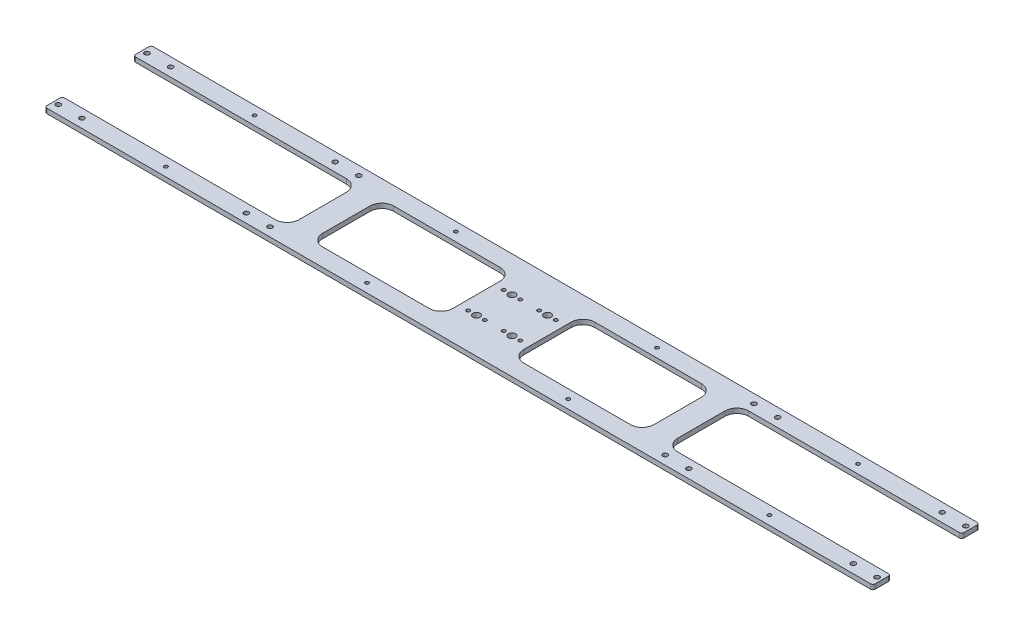
from build123d import *

# Parameters (mm, degrees)
SKETCH_1_W                                   = 700
SKETCH_1_H                                   = 90
SKETCH_1_W_2                                 = 280
SKETCH_1_H_2                                 = 60
EXTRUDE_1_DEPTH                              = 4
SKETCH_2_W                                   = 190
SKETCH_2_H                                   = 60
CUT_EXTRUDE_1_DEPTH                          = 4
SKETCH_4_R                                   = 2
CUT_EXTRUDE_2_DEPTH                          = 15
MIRROR_2_AT_THE_SECOND_PLANE_COPY_1_SKET_R   = 2
MIRROR_2_AT_THE_SECOND_PLANE_COPY_1_DEPTH    = 15
SKETCH_5_W                                   = 60
SKETCH_5_H                                   = 60
EXTRUDE_2_DEPTH                              = 4
SKETCH_6_R                                   = 1.5
CUT_EXTRUDE_3_DEPTH                          = 4
MIRROR_3_AT_THE_SECOND_PLANE_COPY_1_SKET_R   = 1.5
MIRROR_3_AT_THE_SECOND_PLANE_COPY_1_DEPTH    = 4
FILLET_1_R                                   = 2
MIRROR_6_DEPTH                               = 4
EXTRUDE_3_DEPTH                              = 4
MIRROR_9_AT_THE_SECOND_PLANE_COPY_1_DEPTH    = 4
SKETCH_8_R                                   = 3
SKETCH_8_R_2                                 = 1.5
CUT_EXTRUDE_4_DEPTH                          = 15
MIRROR_10_AT_THE_SECOND_PLANE_COPY_1_SKE_R   = 3
MIRROR_10_AT_THE_SECOND_PLANE_COPY_1_SKE_R_2 = 1.5
MIRROR_10_AT_THE_SECOND_PLANE_COPY_1_DEPTH   = 15


# Read off the part's stored shape, not the designer's step: 镜向6
with BuildPart() as part:
    # 草图1 → 凸台-拉伸1 (new body)
    with BuildSketch(Plane(origin=(0, 0, 0), x_dir=(1, 0, 0), z_dir=(0, 1, 0))):
        Rectangle(SKETCH_1_W, SKETCH_1_H)
        Rectangle(SKETCH_1_W_2, SKETCH_1_H_2, mode=Mode.SUBTRACT)
    extrude(amount=EXTRUDE_1_DEPTH)

    # 草图2 → 切除-拉伸1 (cut)
    with BuildSketch(Plane(origin=(0, 4, 0), x_dir=(1, 0, 0), z_dir=(0, 1, 0))):
        with Locations((-255, 0)):
            Rectangle(SKETCH_2_W, SKETCH_2_H)
    cut_extrude_1 = extrude(amount=-CUT_EXTRUDE_1_DEPTH, mode=Mode.SUBTRACT)

    # 镜向1: 切除-拉伸1 across plane
    add(cut_extrude_1.mirror(Plane(origin=(0, 0, 0), x_dir=(0, 0, 1), z_dir=(1, 0, 0))), mode=Mode.SUBTRACT)

    # 草图4 → 切除-拉伸2 (cut)
    with BuildSketch(Plane(origin=(0, 4, 0), x_dir=(1, 0, 0), z_dir=(0, 1, 0))):
        with Locations(Location((-187, 37.5, 0), (0, 0, 270))):
            Circle(SKETCH_4_R)
        with Locations(Location((-167, 37.5, 0), (0, 0, 270))):
            Circle(SKETCH_4_R)
        with Locations(Location((-346, 37.5, 0), (0, 0, 270))):
            Circle(SKETCH_4_R)
        with Locations(Location((-326, 37.5, 0), (0, 0, 270))):
            Circle(SKETCH_4_R)
    cut_extrude_2 = extrude(amount=-CUT_EXTRUDE_2_DEPTH, mode=Mode.SUBTRACT)

    # 镜向2: 切除-拉伸2 across plane
    add(cut_extrude_2.mirror(Plane(origin=(0, 0, 0), x_dir=(0, 0, 1), z_dir=(1, 0, 0))), mode=Mode.SUBTRACT)

    # 镜向2 at the second plane: 切除-拉伸2 across plane
    add(cut_extrude_2.mirror(Plane.XY), mode=Mode.SUBTRACT)

    # 镜向2 at the second plane copy 1 sket → 镜向2 at the second plane copy 1 (cut)
    with BuildSketch(Plane(origin=(0, 4, 0), x_dir=(-1, 0, 0), z_dir=(0, 1, 0))):
        with Locations(Location((-187, 37.5, 0), (0, 0, 270))):
            Circle(MIRROR_2_AT_THE_SECOND_PLANE_COPY_1_SKET_R)
        with Locations(Location((-167, 37.5, 0), (0, 0, 270))):
            Circle(MIRROR_2_AT_THE_SECOND_PLANE_COPY_1_SKET_R)
        with Locations(Location((-346, 37.5, 0), (0, 0, 270))):
            Circle(MIRROR_2_AT_THE_SECOND_PLANE_COPY_1_SKET_R)
        with Locations(Location((-326, 37.5, 0), (0, 0, 270))):
            Circle(MIRROR_2_AT_THE_SECOND_PLANE_COPY_1_SKET_R)
    extrude(amount=-MIRROR_2_AT_THE_SECOND_PLANE_COPY_1_DEPTH, mode=Mode.SUBTRACT)

    # 草图5 → 凸台-拉伸2 (add)
    with BuildSketch(Plane(origin=(0, 4, 0), x_dir=(1, 0, 0), z_dir=(0, 1, 0))):
        Rectangle(SKETCH_5_W, SKETCH_5_H)
    extrude(amount=-EXTRUDE_2_DEPTH)

    # 草图6 → 切除-拉伸3 (cut)
    with BuildSketch(Plane(origin=(0, 4, 0), x_dir=(1, 0, 0), z_dir=(0, 1, 0))):
        with Locations(Location((-255, 37.5, 0), (0, 0, 270))):
            Circle(SKETCH_6_R)
        with Locations(Location((-85, 37.5, 0), (0, 0, 270))):
            Circle(SKETCH_6_R)
    cut_extrude_3 = extrude(amount=-CUT_EXTRUDE_3_DEPTH, mode=Mode.SUBTRACT)

    # 镜向3: 切除-拉伸3 across plane
    add(cut_extrude_3.mirror(Plane.XY), mode=Mode.SUBTRACT)

    # 镜向3 at the second plane: 切除-拉伸3 across plane
    add(cut_extrude_3.mirror(Plane(origin=(0, 0, 0), x_dir=(0, 0, 1), z_dir=(1, 0, 0))), mode=Mode.SUBTRACT)

    # 镜向3 at the second plane copy 1 sket → 镜向3 at the second plane copy 1 (cut)
    with BuildSketch(Plane(origin=(0, 4, 0), x_dir=(-1, 0, 0), z_dir=(0, 1, 0))):
        with Locations(Location((-255, 37.5, 0), (0, 0, 270))):
            Circle(MIRROR_3_AT_THE_SECOND_PLANE_COPY_1_SKET_R)
        with Locations(Location((-85, 37.5, 0), (0, 0, 270))):
            Circle(MIRROR_3_AT_THE_SECOND_PLANE_COPY_1_SKET_R)
    extrude(amount=-MIRROR_3_AT_THE_SECOND_PLANE_COPY_1_DEPTH, mode=Mode.SUBTRACT)

    # 圆角1
    fillet_1_edges = [part.edges().sort_by_distance(p)[0] for p in [
        (-350, 2, -30),
        (-350, 2, -45),
    ]]
    fillet(fillet_1_edges, radius=FILLET_1_R)

    # 镜向6 outline → 镜向6 (cut)
    with BuildSketch(Plane(origin=(0, 0, 0), x_dir=(1, 0, 0), z_dir=(0, 1, 0))):
        with BuildLine():
            Line((350, 45), (348, 45))
            ThreePointArc((348, 45), (349.414213562, 44.414213562), (350, 43))
            Line((350, 43), (350, 45))
        make_face()
        with BuildLine():
            Line((350, 30), (350, 32))
            ThreePointArc((350, 32), (349.414213562, 30.585786438), (348, 30))
            Line((348, 30), (350, 30))
        make_face()
        with BuildLine():
            Line((-350, -45), (-348, -45))
            ThreePointArc((-348, -45), (-349.414213562, -44.414213562), (-350, -43))
            Line((-350, -43), (-350, -45))
        make_face()
        with BuildLine():
            ThreePointArc((348, -30), (349.414213562, -30.585786438), (350, -32))
            Line((350, -32), (350, -30))
            Line((350, -30), (348, -30))
        make_face()
        with BuildLine():
            ThreePointArc((350, -43), (349.414213562, -44.414213562), (348, -45))
            Line((348, -45), (350, -45))
            Line((350, -45), (350, -43))
        make_face()
        with BuildLine():
            Line((-350, -30), (-350, -32))
            ThreePointArc((-350, -32), (-349.414213562, -30.585786438), (-348, -30))
            Line((-348, -30), (-350, -30))
        make_face()
    extrude(amount=MIRROR_6_DEPTH, mode=Mode.SUBTRACT)

    # 草图7 → 凸台-拉伸3 (add)
    with BuildSketch(Plane(origin=(0, 4, 0), x_dir=(1, 0, 0), z_dir=(0, 1, 0))):
        with BuildLine():
            Line((-170, 30), (-160, 30))
            Line((-160, 30), (-160, 20))
            ThreePointArc((-160, 20), (-162.928932188, 27.071067812), (-170, 30))
        make_face()
        with BuildLine():
            Line((-140, 20), (-140, 30))
            Line((-140, 30), (-130, 30))
            ThreePointArc((-130, 30), (-137.071067812, 27.071067812), (-140, 20))
        make_face()
        with BuildLine():
            Line((-40, 30), (-30, 30))
            Line((-30, 30), (-30, 20))
            ThreePointArc((-30, 20), (-32.928932188, 27.071067812), (-40, 30))
        make_face()
    extrude_3 = extrude(amount=-EXTRUDE_3_DEPTH)

    # 镜向9: 凸台-拉伸3 across plane
    add(extrude_3.mirror(Plane(origin=(0, 0, 0), x_dir=(0, 0, 1), z_dir=(1, 0, 0))))

    # 镜向9 at the second plane: 凸台-拉伸3 across plane
    add(extrude_3.mirror(Plane.XY))

    # 镜向9 at the second plane copy 1 sket → 镜向9 at the second plane copy 1 (add)
    with BuildSketch(Plane(origin=(0, 4, 0), x_dir=(-1, 0, 0), z_dir=(0, 1, 0))):
        with BuildLine():
            Line((-170, 30), (-160, 30))
            Line((-160, 30), (-160, 20))
            ThreePointArc((-160, 20), (-162.928932188, 27.071067812), (-170, 30))
        make_face()
        with BuildLine():
            Line((-140, 20), (-140, 30))
            Line((-140, 30), (-130, 30))
            ThreePointArc((-130, 30), (-137.071067812, 27.071067812), (-140, 20))
        make_face()
        with BuildLine():
            Line((-40, 30), (-30, 30))
            Line((-30, 30), (-30, 20))
            ThreePointArc((-30, 20), (-32.928932188, 27.071067812), (-40, 30))
        make_face()
    extrude(amount=-MIRROR_9_AT_THE_SECOND_PLANE_COPY_1_DEPTH)

    # 草图8 → 切除-拉伸4 (cut)
    with BuildSketch(Plane(origin=(0, 4, 0), x_dir=(1, 0, 0), z_dir=(0, 1, 0))):
        with Locations(Location((-15, 15, 0), (0, 0, 270))):
            Circle(SKETCH_8_R)
        with Locations(Location((-22, 15, 0), (0, 0, 270))):
            Circle(SKETCH_8_R_2)
        with Locations(Location((-8, 15, 0), (0, 0, 270))):
            Circle(SKETCH_8_R_2)
    cut_extrude_4 = extrude(amount=-CUT_EXTRUDE_4_DEPTH, mode=Mode.SUBTRACT)

    # 镜向10: 切除-拉伸4 across plane
    add(cut_extrude_4.mirror(Plane.XY), mode=Mode.SUBTRACT)

    # 镜向10 at the second plane: 切除-拉伸4 across plane
    add(cut_extrude_4.mirror(Plane(origin=(0, 0, 0), x_dir=(0, 0, 1), z_dir=(1, 0, 0))), mode=Mode.SUBTRACT)

    # 镜向10 at the second plane copy 1 ske → 镜向10 at the second plane copy 1 (cut)
    with BuildSketch(Plane(origin=(0, 4, 0), x_dir=(-1, 0, 0), z_dir=(0, 1, 0))):
        with Locations(Location((-15, 15, 0), (0, 0, 270))):
            Circle(MIRROR_10_AT_THE_SECOND_PLANE_COPY_1_SKE_R)
        with Locations(Location((-22, 15, 0), (0, 0, 270))):
            Circle(MIRROR_10_AT_THE_SECOND_PLANE_COPY_1_SKE_R_2)
        with Locations(Location((-8, 15, 0), (0, 0, 270))):
            Circle(MIRROR_10_AT_THE_SECOND_PLANE_COPY_1_SKE_R_2)
    extrude(amount=-MIRROR_10_AT_THE_SECOND_PLANE_COPY_1_DEPTH, mode=Mode.SUBTRACT)


solid = part.part
